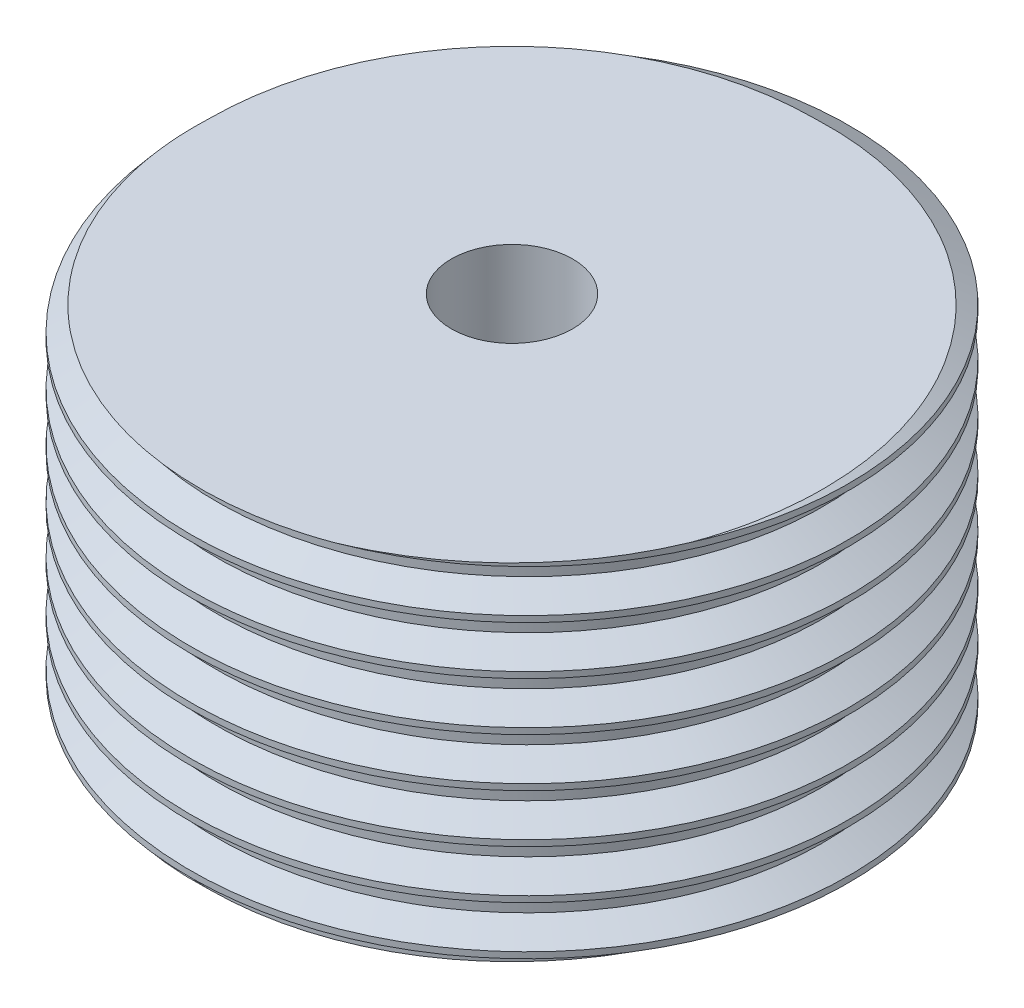
from build123d import *

# Parameters (mm, degrees)
CROQUIS1_R              = 12.5
SALIENTE_EXTRUIR1_DEPTH = 15
ROSCA1_PITCH            = 2
ROSCA1_FROM             = 2
ROSCA1_TO               = 17
CROQUIS4_R              = 2.5
CORTAR_EXTRUIR1_DEPTH   = 25.371506856


with BuildPart() as part:
    # Croquis1 → Saliente-Extruir1 (new body)
    with BuildSketch(Plane(origin=(0, 0, 0), x_dir=(1, 0, 0), z_dir=(0, 1, 0))):
        with Locations(Location((0, 0, 0), (0, 0, 270))):
            Circle(CROQUIS1_R)
    extrude(amount=SALIENTE_EXTRUIR1_DEPTH)

    # Rosca1: arcs per turn and ends read off the stored shape
    # Rosca1: the profile of Perfil de rosca1 profile screwed along a left-hand helix through 9.5 turns, 10 arcs to a turn; built about Z, then put on its axis
    rosca1_z = Axis((0, 0, 0), (0, 0, 1))
    rosca1_corners = [(12.4997, 0, -0.000173205), (13.58253175, 0, 0.624999997), (13.58253175, 0, 0.874999997), (12.4997, 0, 1.5001732)]
    with BuildLine(mode=Mode.PRIVATE) as rosca1_profile:
        Line(rosca1_corners[0], rosca1_corners[1])
        Line(rosca1_corners[1], rosca1_corners[2])
        Line(rosca1_corners[2], rosca1_corners[3])
        Line(rosca1_corners[3], rosca1_corners[0])
    rosca1_cap = Face(rosca1_profile.wire())
    rosca1_turn_angles = [0, -18, -36, -54, -72, -90, -108, -126, -144, -162, -180, -198, -216, -234, -252, -270, -288, -306, -324, -342, -360]
    rosca1_turn_weights = [1, 0.9510565162951535, 1, 0.9510565162951535, 1, 0.9510565162951535, 1, 0.9510565162951535, 1, 0.9510565162951535, 1, 0.9510565162951535, 1, 0.9510565162951535, 1, 0.9510565162951535, 1, 0.9510565162951535, 1, 0.9510565162951535, 1]
    rosca1_turn_rails = [Edge.make_bspline([Vector(p[0], p[1], 0).rotate(rosca1_z, rosca1_turn_angles[k]) / rosca1_turn_weights[k] + Vector(0, 0, p[2] + -ROSCA1_PITCH * rosca1_turn_angles[k] / 360) for k in range(21)], [0, 0, 0, 1, 1, 2, 2, 3, 3, 4, 4, 5, 5, 6, 6, 7, 7, 8, 8, 9, 9, 10, 10, 10], 2, rosca1_turn_weights) for p in rosca1_corners]
    rosca1_turn_sides = [Face.make_surface_from_curves(rosca1_turn_rails[p[0]], rosca1_turn_rails[p[1]]) for p in [(0, 1), (1, 2), (2, 3), (3, 0)]]
    rosca1_last_angles = [-3240, -3258, -3276, -3294, -3312, -3330, -3348, -3366, -3384, -3402, -3420]
    rosca1_last_weights = [1, 0.9510565162951535, 1, 0.9510565162951535, 1, 0.9510565162951535, 1, 0.9510565162951535, 1, 0.9510565162951535, 1]
    rosca1_last_rails = [Edge.make_bspline([Vector(p[0], p[1], 0).rotate(rosca1_z, rosca1_last_angles[k]) / rosca1_last_weights[k] + Vector(0, 0, p[2] + -ROSCA1_PITCH * rosca1_last_angles[k] / 360) for k in range(11)], [0, 0, 0, 1, 1, 2, 2, 3, 3, 4, 4, 5, 5, 5], 2, rosca1_last_weights) for p in rosca1_corners]
    rosca1_last_sides = [Face.make_surface_from_curves(rosca1_last_rails[p[0]], rosca1_last_rails[p[1]]) for p in [(0, 1), (1, 2), (2, 3), (3, 0)]]
    rosca1 = Plane(origin=(0, -2, 0), x_dir=(1, 0, 0), z_dir=(0, 1, 0)) * split(split(Solid(Shell([*[p.moved(Location((0, 0, ROSCA1_PITCH * i))) for i in range(9) for p in rosca1_turn_sides], *rosca1_last_sides, rosca1_cap, rosca1_cap.rotate(rosca1_z, -3420).moved(Location((0, 0, -ROSCA1_PITCH * -3420 / 360)))])), bisect_by=Plane.XY.offset(ROSCA1_FROM), keep=Keep.TOP, mode=Mode.PRIVATE), bisect_by=Plane.XY.offset(ROSCA1_TO), keep=Keep.BOTTOM, mode=Mode.PRIVATE)
    add(rosca1)

    # Croquis4 → Cortar-Extruir1 (cut, through all)
    with BuildSketch(Plane.XZ):
        with Locations(Location((0, 0, 0), (0, 0, 270))):
            Circle(CROQUIS4_R)
    extrude(amount=-CORTAR_EXTRUIR1_DEPTH, mode=Mode.SUBTRACT)


solid = part.part
